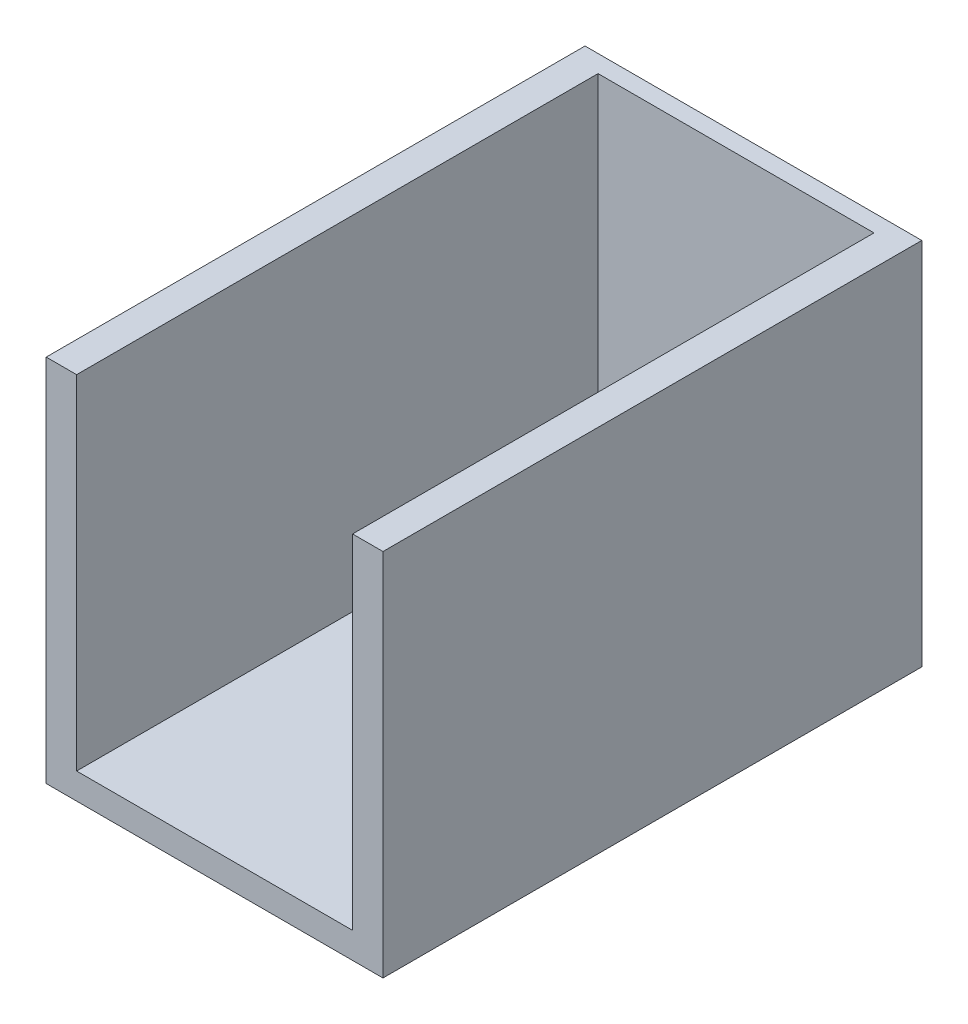
from build123d import *

# Parameters (mm, degrees)
BRKT_1_5_6_BOSS_EXTRUDE1_START       = -6
BRKT_1_5_6_BOSS_EXTRUDE1_OUTLINE_W   = 7
BRKT_1_5_6_BOSS_EXTRUDE1_OUTLINE_H   = 120
BRKT_1_5_6_BOSS_EXTRUDE1_DEPTH       = 85
BRKT_1_5_6_BOSS_EXTRUDE1_2_OUTLINE_W = 63.5
BRKT_1_5_6_BOSS_EXTRUDE1_2_OUTLINE_H = 120
BRKT_1_5_6_BOSS_EXTRUDE1_2_DEPTH     = 6
SKETCH1_W                            = 77.5
SKETCH1_H                            = 85
BOSS_EXTRUDE1_DEPTH                  = 4


# Read off the part's stored shape, not the designer's step: <BRKT_1_5_6>-<Boss-Extrude1>
with BuildPart() as part:
    # <BRKT_1_5_6>-<Boss-Extrude1> outline → <BRKT_1_5_6>-<Boss-Extrude1> (new body)
    with BuildSketch(Plane(origin=(0, 0, 0), x_dir=(1, 0, 0), z_dir=(0, 1, 0)).offset(BRKT_1_5_6_BOSS_EXTRUDE1_START)):
        with Locations((35.25, 0)):
            Rectangle(BRKT_1_5_6_BOSS_EXTRUDE1_OUTLINE_W, BRKT_1_5_6_BOSS_EXTRUDE1_OUTLINE_H)
        with Locations((-35.25, 0)):
            Rectangle(BRKT_1_5_6_BOSS_EXTRUDE1_OUTLINE_W, BRKT_1_5_6_BOSS_EXTRUDE1_OUTLINE_H)
    extrude(amount=BRKT_1_5_6_BOSS_EXTRUDE1_DEPTH)

    # BRKT_1_5_6_-_Boss-Extrude1 2 outline → BRKT_1_5_6_-_Boss-Extrude1 2 (add)
    with BuildSketch(Plane(origin=(0, 0, 0), x_dir=(1, 0, 0), z_dir=(0, 1, 0)).offset(BRKT_1_5_6_BOSS_EXTRUDE1_START)):
        Rectangle(BRKT_1_5_6_BOSS_EXTRUDE1_2_OUTLINE_W, BRKT_1_5_6_BOSS_EXTRUDE1_2_OUTLINE_H)
    extrude(amount=BRKT_1_5_6_BOSS_EXTRUDE1_2_DEPTH)

    # Sketch1 → Boss-Extrude1 (add)
    with BuildSketch(Plane(origin=(0, 0, -60), x_dir=(-1, 0, 0), z_dir=(0, 0, -1))):
        with Locations((0, 36.5)):
            Rectangle(SKETCH1_W, SKETCH1_H)
    extrude(amount=BOSS_EXTRUDE1_DEPTH)


solid = part.part
